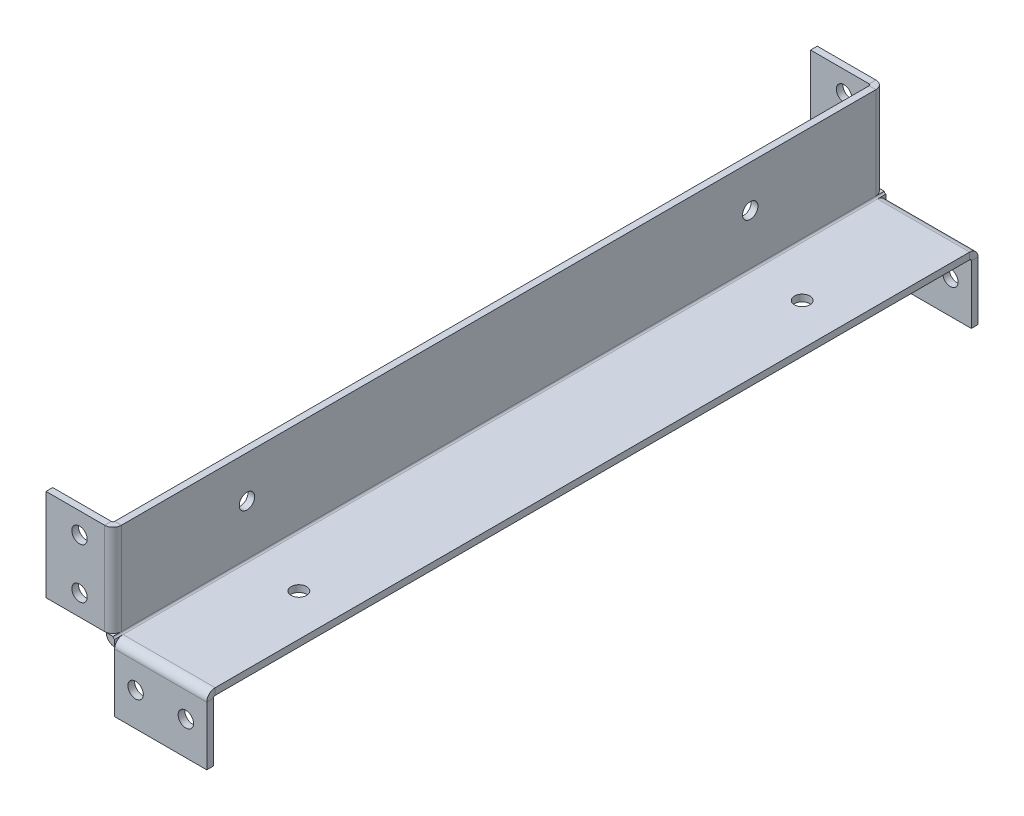
from build123d import *

# Parameters (mm, degrees)
SKETCH1_W                      = 60
SKETCH1_H                      = 460.5
BASE_FLANGE1_DEPTH             = 4
EDGE_FLANGE1_STRIP_W           = 18
EDGE_FLANGE1_STRIP_H           = 4
EDGE_FLANGE1_STRIP_CUT_DEPTH   = 460.5
EDGE_FLANGE1_DEPTH             = 460.5
EDGE_FLANGE2_STRIP_W           = 18
EDGE_FLANGE2_STRIP_H           = 4
EDGE_FLANGE2_STRIP_CUT_DEPTH   = 55
EDGE_FLANGE2_STRIP_2_W         = 18
EDGE_FLANGE2_STRIP_2_H         = 4
EDGE_FLANGE2_STRIP_CUT_2_DEPTH = 55
EDGE_FLANGE2_STRIP_3_W         = 18
EDGE_FLANGE2_STRIP_3_H         = 4
EDGE_FLANGE2_STRIP_CUT_3_DEPTH = 55
EDGE_FLANGE2_STRIP_4_W         = 18
EDGE_FLANGE2_STRIP_4_H         = 4
EDGE_FLANGE2_STRIP_CUT_4_DEPTH = 55
EDGE_FLANGE2_DEPTH             = 55
EDGE_FLANGE2_BEND_DEPTH        = 55
EDGE_FLANGE2_BEND_2_DEPTH      = 55
EDGE_FLANGE2_BEND_3_DEPTH      = 55
SKETCH18_R                     = 4.6
EXTRUDE1_DEPTH                 = 470.058898221
SKETCH19_R                     = 4.6
EXTRUDE2_DEPTH                 = 4
SKETCH20_R                     = 4.6
EXTRUDE3_DEPTH                 = 4


# Sheet-metal steps are written as plain solids
with BuildPart() as part:
    # Sketch1 → Base-Flange1 (new body)
    with BuildSketch(Plane(origin=(0, 0, 0), x_dir=(1, 0, 0), z_dir=(0, 1, 0))):
        Rectangle(SKETCH1_W, SKETCH1_H)
    extrude(amount=BASE_FLANGE1_DEPTH)

    # Edge-Flange1 strip (across the edge) → Edge-Flange1 strip cut (cut)
    with BuildSketch(Plane(origin=(-30, 4, -230.25), x_dir=(1, 0, 0), z_dir=(0, 0, 1))):
        with Locations((-4, -2)):
            Rectangle(EDGE_FLANGE1_STRIP_W, EDGE_FLANGE1_STRIP_H)
    extrude(amount=EDGE_FLANGE1_STRIP_CUT_DEPTH, mode=Mode.SUBTRACT)

    # Edge-Flange1 section (across the edge) → Edge-Flange1 (add)
    with BuildSketch(Plane(origin=(-30, 4, -230.25), x_dir=(1, 0, 0), z_dir=(0, 0, 1))):
        with BuildLine():
            Line((0, 1), (0, 56))
            Line((0, 56), (4, 56))
            Line((4, 56), (4, 1))
            ThreePointArc((4, 1), (4.292893219, 0.292893219), (5, 0))
            Line((5, 0), (5, -4))
            ThreePointArc((5, -4), (1.464466094, -2.535533906), (0, 1))
        make_face()
    extrude(amount=EDGE_FLANGE1_DEPTH)

    # Edge-Flange2 strip (across the edge) → Edge-Flange2 strip cut (cut)
    with BuildSketch(Plane(origin=(-30, 5, 230.25), x_dir=(0, 0, -1), z_dir=(0, 1, 0))):
        with Locations((-4, -2)):
            Rectangle(EDGE_FLANGE2_STRIP_W, EDGE_FLANGE2_STRIP_H)
    extrude(amount=EDGE_FLANGE2_STRIP_CUT_DEPTH, mode=Mode.SUBTRACT)

    # Edge-Flange2 strip 2 (across the edge) → Edge-Flange2 strip cut 2 (cut)
    with BuildSketch(Plane(origin=(30, 0, 230.25), x_dir=(0, 0, -1), z_dir=(-1, 0, 0))):
        with Locations((-4, -2)):
            Rectangle(EDGE_FLANGE2_STRIP_2_W, EDGE_FLANGE2_STRIP_2_H)
    extrude(amount=EDGE_FLANGE2_STRIP_CUT_2_DEPTH, mode=Mode.SUBTRACT)

    # Edge-Flange2 strip 3 (across the edge) → Edge-Flange2 strip cut 3 (cut)
    with BuildSketch(Plane(origin=(-30, 60, -230.25), x_dir=(0, 0, 1), z_dir=(0, -1, 0))):
        with Locations((-4, -2)):
            Rectangle(EDGE_FLANGE2_STRIP_3_W, EDGE_FLANGE2_STRIP_3_H)
    extrude(amount=EDGE_FLANGE2_STRIP_CUT_3_DEPTH, mode=Mode.SUBTRACT)

    # Edge-Flange2 strip 4 (across the edge) → Edge-Flange2 strip cut 4 (cut)
    with BuildSketch(Plane(origin=(-25, 0, -230.25), x_dir=(0, 0, 1), z_dir=(1, 0, 0))):
        with Locations((-4, -2)):
            Rectangle(EDGE_FLANGE2_STRIP_4_W, EDGE_FLANGE2_STRIP_4_H)
    extrude(amount=EDGE_FLANGE2_STRIP_CUT_4_DEPTH, mode=Mode.SUBTRACT)

    # Edge-Flange2 section (across the edge) → Edge-Flange2 (add)
    with BuildSketch(Plane(origin=(-30, 5, 230.25), x_dir=(0, 0, -1), z_dir=(0, 1, 0))):
        with BuildLine():
            Line((0, 1), (0, 36))
            Line((0, 36), (4, 36))
            Line((4, 36), (4, 1))
            ThreePointArc((4, 1), (4.292893219, 0.292893219), (5, 0))
            Line((5, 0), (5, -4))
            ThreePointArc((5, -4), (1.464466094, -2.535533906), (0, 1))
        make_face()
    extrude(amount=EDGE_FLANGE2_DEPTH)

    # Edge-Flange2 section 2 (across the edge) → Edge-Flange2 bend (add)
    with BuildSketch(Plane(origin=(30, 0, 230.25), x_dir=(0, 0, -1), z_dir=(-1, 0, 0))):
        with BuildLine():
            Line((0, 1), (0, 36))
            Line((0, 36), (4, 36))
            Line((4, 36), (4, 1))
            ThreePointArc((4, 1), (4.292893219, 0.292893219), (5, 0))
            Line((5, 0), (5, -4))
            ThreePointArc((5, -4), (1.464466094, -2.535533906), (0, 1))
        make_face()
    extrude(amount=EDGE_FLANGE2_BEND_DEPTH)

    # Edge-Flange2 section 3 (across the edge) → Edge-Flange2 bend 2 (add)
    with BuildSketch(Plane(origin=(-30, 60, -230.25), x_dir=(0, 0, 1), z_dir=(0, -1, 0))):
        with BuildLine():
            Line((0, 1), (0, 36))
            Line((0, 36), (4, 36))
            Line((4, 36), (4, 1))
            ThreePointArc((4, 1), (4.292893219, 0.292893219), (5, 0))
            Line((5, 0), (5, -4))
            ThreePointArc((5, -4), (1.464466094, -2.535533906), (0, 1))
        make_face()
    extrude(amount=EDGE_FLANGE2_BEND_2_DEPTH)

    # Edge-Flange2 section 4 (across the edge) → Edge-Flange2 bend 3 (add)
    with BuildSketch(Plane(origin=(-25, 0, -230.25), x_dir=(0, 0, 1), z_dir=(1, 0, 0))):
        with BuildLine():
            Line((0, 1), (0, 36))
            Line((0, 36), (4, 36))
            Line((4, 36), (4, 1))
            ThreePointArc((4, 1), (4.292893219, 0.292893219), (5, 0))
            Line((5, 0), (5, -4))
            ThreePointArc((5, -4), (1.464466094, -2.535533906), (0, 1))
        make_face()
    extrude(amount=EDGE_FLANGE2_BEND_3_DEPTH)

    # Sketch18 → Extrude1 (cut, through all)
    with BuildSketch(Plane.XY.offset(230.25)):
        with Locations((-46, 47.5)):
            Circle(SKETCH18_R)
        with Locations((-46, 17.5)):
            Circle(SKETCH18_R)
        with Locations((-12.5, -16)):
            Circle(SKETCH18_R)
        with Locations((17.5, -16)):
            Circle(SKETCH18_R)
    extrude(amount=-EXTRUDE1_DEPTH, mode=Mode.SUBTRACT)

    # Sketch19 → Extrude2 (cut)
    with BuildSketch(Plane(origin=(-26, 0, 0), x_dir=(0, 0, -1), z_dir=(1, 0, 0))):
        with Locations(Location((-150.25, 35, 0), (0, 0, 90))):
            Circle(SKETCH19_R)
        with Locations(Location((150.25, 35, 0), (0, 0, 90))):
            Circle(SKETCH19_R)
    extrude(amount=-EXTRUDE2_DEPTH, mode=Mode.SUBTRACT)

    # Sketch20 → Extrude3 (cut)
    with BuildSketch(Plane(origin=(0, 4, 0), x_dir=(1, 0, 0), z_dir=(0, 1, 0))):
        with Locations(Location((5, 150.25, 0), (0, 0, 270))):
            Circle(SKETCH20_R)
        with Locations(Location((5, -150.25, 0), (0, 0, 270))):
            Circle(SKETCH20_R)
    extrude(amount=-EXTRUDE3_DEPTH, mode=Mode.SUBTRACT)


solid = part.part
